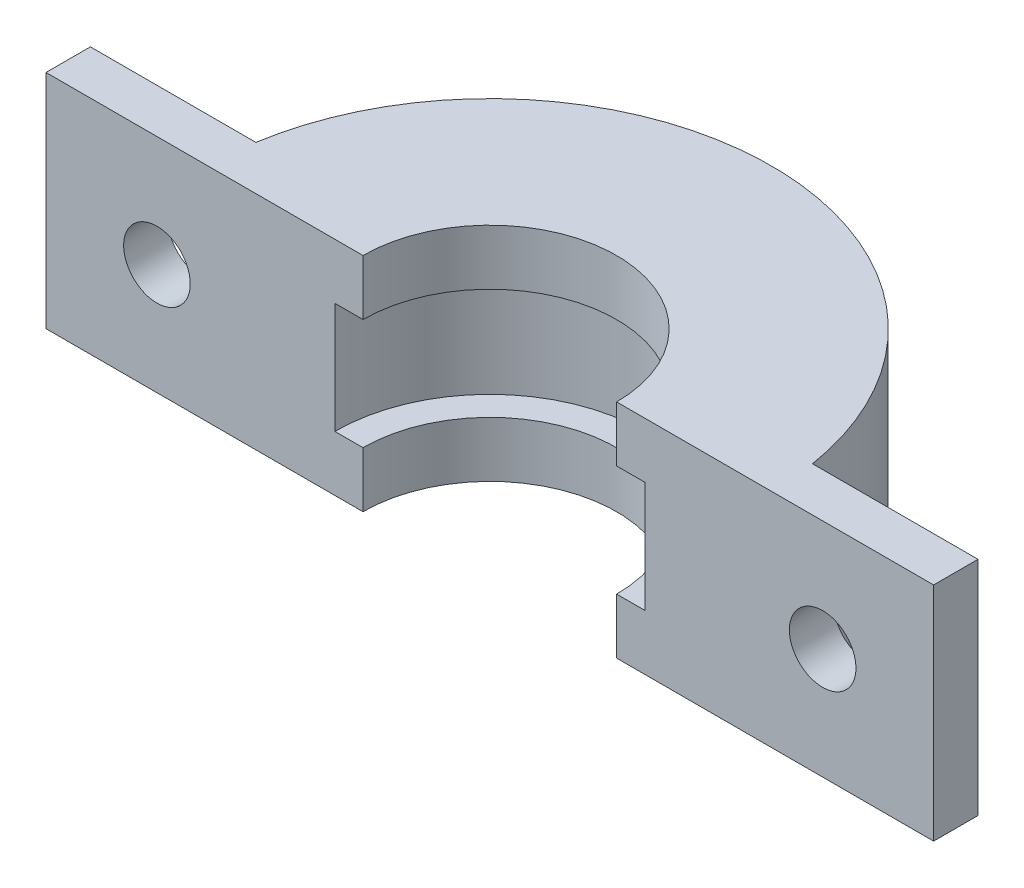
from build123d import *

# Parameters (mm, degrees)
BOSS_EXTRUDE1_DEPTH = 5
CUT_EXTRUDE1_DEPTH  = 2.5
SKETCH3_W           = 9
SKETCH3_H           = 10
SKETCH3_R           = 1.5
BOSS_EXTRUDE2_DEPTH = 2


with BuildPart() as part:
    # Sketch1 → Boss-Extrude1 (new, symmetric)
    with BuildSketch(Plane(origin=(0, 0, 0), x_dir=(1, 0, 0), z_dir=(0, 1, 0))):
        with BuildLine():
            Line((5.715, 0), (12.7, 0))
            ThreePointArc((12.7, 0), (0, 12.7), (-12.7, 0))
            Line((-12.7, 0), (-5.715, 0))
            ThreePointArc((-5.715, 0), (0, 5.715), (5.715, 0))
        make_face()
    extrude(amount=BOSS_EXTRUDE1_DEPTH, both=True)

    # Sketch2 → Cut-Extrude1 (cut, symmetric)
    with BuildSketch(Plane(origin=(0, 0, 0), x_dir=(1, 0, 0), z_dir=(0, 1, 0))):
        with BuildLine():
            ThreePointArc((6.985, 0), (0, 6.985), (-6.985, 0))
            Line((-6.985, 0), (6.985, 0))
        make_face()
    extrude(amount=CUT_EXTRUDE1_DEPTH, both=True, mode=Mode.SUBTRACT)

    # Sketch3 → Boss-Extrude2 (add)
    # profile 1 of 2: a face of its own
    with BuildSketch(Plane.XY):
        with Locations((15.5, 0)):
            Rectangle(SKETCH3_W, SKETCH3_H)
        with Locations((15, 0)):
            Circle(SKETCH3_R, mode=Mode.SUBTRACT)
    # profile 2 of 2: a face of its own
    with BuildSketch(Plane.XY):
        with Locations((-15.5, 0)):
            Rectangle(SKETCH3_W, SKETCH3_H)
        with Locations((-15, 0)):
            Circle(SKETCH3_R, mode=Mode.SUBTRACT)
    extrude(amount=-BOSS_EXTRUDE2_DEPTH)


solid = part.part
